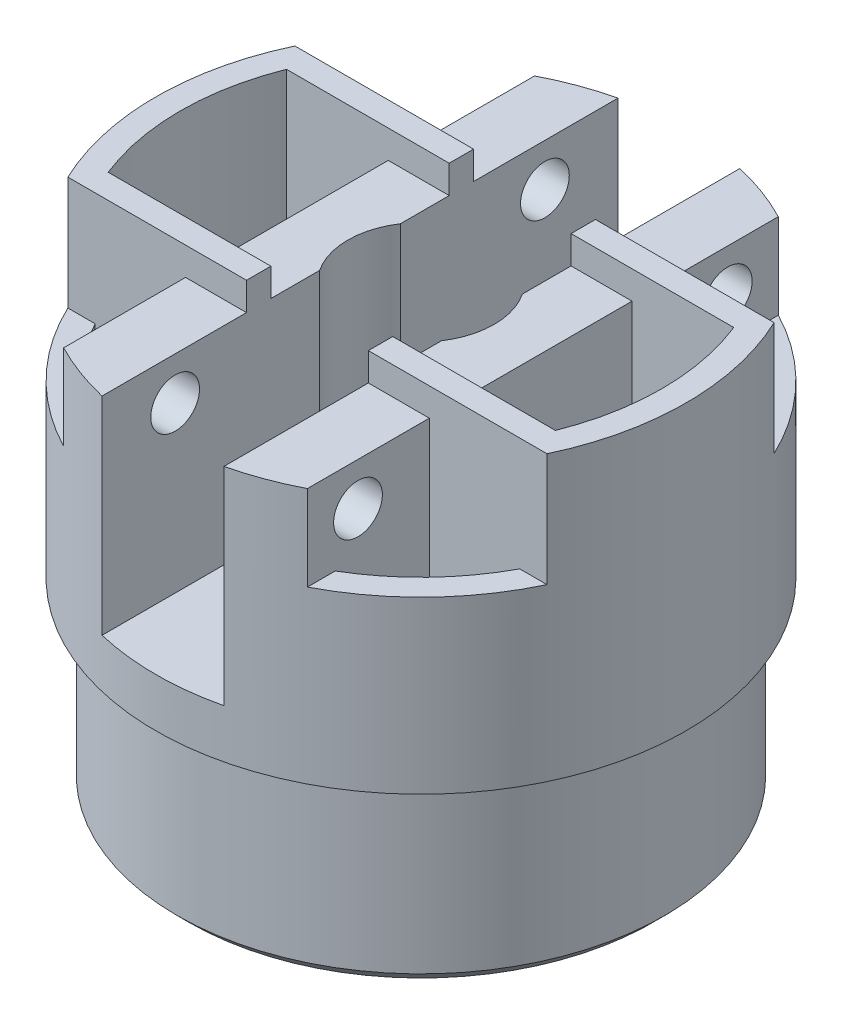
from build123d import *
from build123d.topology import SkipClean

# Parameters (mm, degrees)
HINGE_DEPTH           = 8.89
HINGE_2_DEPTH         = 8.89
SKETCH2_R             = 2.54
HINGE_HOLES_DEPTH     = 50.270844447
BODY_START            = 12.7
BODY_DEPTH            = 12.7
BOTTOM_PLATE_START    = 5.08
BOTTOM_PLATE_DEPTH    = 5.08
TUBE_CONNECTION_DEPTH = 19.05
BACKSTOP_DEPTH        = 2.921
CONNECT_TO_BASE_START = 12.7
CONNECT_TO_BASE_DEPTH = 12.7
SKETCH13_R            = 7.62
BOLT_ACCESS_DEPTH     = 21.59
BOTTOM_CHAMFER_SIZE   = 1.27


with BuildPart() as part:
    # Sketch1 → hinge (new body)
    with BuildSketch(Plane(origin=(0, 0, 0), x_dir=(1, 0, 0), z_dir=(0, 1, 0))):
        with BuildLine():
            ThreePointArc((-6.35, 26.882708313), (-9.597376484, 25.901599774), (-12.7, 24.529828908))
            Line((-12.7, 24.529828908), (-12.7, 11.829828908))
            Line((-12.7, 11.829828908), (-24.961122857, 11.829828908))
            ThreePointArc((-24.961122857, 11.829828908), (-26.9489436, 6.062750619), (-27.6225, 0))
            Line((-27.6225, 0), (-25.0825, 0))
            ThreePointArc((-25.0825, 0), (-24.632521559, 4.729766155), (-23.298731406, 9.289828908))
            Line((-23.298731406, 9.289828908), (-12.7, 9.289828908))
            Line((-12.7, 9.289828908), (-12.7, 0))
            Line((-12.7, 0), (-6.35, 0))
            Line((-6.35, 0), (-6.35, 26.882708313))
        make_face()
    hinge = extrude(amount=HINGE_DEPTH)


with BuildPart() as body_2:
    # Sketch1 → hinge 2 (new body)
    with BuildSketch(Plane(origin=(0, 0, 0), x_dir=(1, 0, 0), z_dir=(0, 1, 0))):
        with BuildLine():
            ThreePointArc((12.7, 24.529828908), (9.597376484, 25.901599774), (6.35, 26.882708313))
            Line((6.35, 26.882708313), (6.35, 0))
            Line((6.35, 0), (12.7, 0))
            Line((12.7, 0), (12.7, 9.289828908))
            Line((12.7, 9.289828908), (23.298731406, 9.289828908))
            ThreePointArc((23.298731406, 9.289828908), (24.632521559, 4.729766155), (25.0825, 0))
            Line((25.0825, 0), (27.6225, 0))
            ThreePointArc((27.6225, 0), (26.9489436, 6.062750619), (24.961122857, 11.829828908))
            Line((24.961122857, 11.829828908), (12.7, 11.829828908))
            Line((12.7, 11.829828908), (12.7, 24.529828908))
        make_face()
    hinge_2 = extrude(amount=HINGE_2_DEPTH)


with BuildPart() as hinge_holes_tool:
    # Sketch2 → hinge_holes (new, through all)
    with BuildSketch(Plane(origin=(12.7, 0, 0), x_dir=(0, 0, -1), z_dir=(1, 0, 0))):
        with Locations((19.262708313, 4.445)):
            Circle(SKETCH2_R)
    hinge_holes = extrude(amount=-HINGE_HOLES_DEPTH)


with BuildPart() as part_1:
    add(part.part)

    # hinge_holes: cut by hinge_holes_tool
    add(hinge_holes_tool.part, mode=Mode.SUBTRACT)



with BuildPart() as body_2_1:
    add(body_2.part)

    # hinge_holes: cut by hinge_holes_tool
    add(hinge_holes_tool.part, mode=Mode.SUBTRACT)


with BuildPart() as part_2:
    add(part_1.part)

    add(body_2_1.part)  # body merges body 2
    # Sketch5 → body (add)
    with BuildSketch(Plane.XZ.offset(BODY_START)):
        with BuildLine():
            Line((-27.6225, 0), (-25.0825, 0))
            ThreePointArc((-25.0825, 0), (-19.854542065, -15.327392656), (-6.35, -24.265393181))
            Line((-6.35, -24.265393181), (-6.35, -26.882708313))
            ThreePointArc((-6.35, -26.882708313), (-21.661087014, -17.140589711), (-27.6225, 0))
        make_face()
        with BuildLine():
            Line((25.0825, 0), (27.6225, 0))
            ThreePointArc((27.6225, 0), (21.661087014, -17.140589711), (6.35, -26.882708313))
            Line((6.35, -26.882708313), (6.35, -24.265393181))
            ThreePointArc((6.35, -24.265393181), (19.854542065, -15.327392656), (25.0825, 0))
        make_face()
    body = extrude(amount=-BODY_DEPTH)

    # Sketch6 → bottom_plate (add)
    with SkipClean():  # the faces are left unmerged after this step: merging them gives an invalid solid
        with BuildSketch(Plane.XZ.offset(12.7).offset(BOTTOM_PLATE_START)):
            with BuildLine():
                Line((13.97, 0), (3.81, 0))
                ThreePointArc((3.81, 0), (0, -3.81), (-3.81, 0))
                Line((-3.81, 0), (-13.97, 0))
                ThreePointArc((-13.97, 0), (-17.78, -3.81), (-21.59, 0))
                Line((-21.59, 0), (-27.6225, 0))
                ThreePointArc((-27.6225, 0), (0, -27.6225), (27.6225, 0))
                Line((27.6225, 0), (21.59, 0))
                ThreePointArc((21.59, 0), (17.78, -3.81), (13.97, 0))
            make_face()
        bottom_plate = extrude(amount=-BOTTOM_PLATE_DEPTH)

    # Sketch7 → tube_connection (add)
    with SkipClean():  # the faces are left unmerged after this step: merging them gives an invalid solid
        with BuildSketch(Plane.XZ.offset(17.78)):
            with BuildLine():
                Line((-22.86, 0), (-25.4, 0))
                ThreePointArc((-25.4, 0), (0, -25.4), (25.4, 0))
                Line((25.4, 0), (22.86, 0))
                ThreePointArc((22.86, 0), (0, -22.86), (-22.86, 0))
            make_face()
        tube_connection = extrude(amount=TUBE_CONNECTION_DEPTH)

    # Sketch10 → backstop (add)
    with SkipClean():  # the faces are left unmerged after this step: merging them gives an invalid solid
        with BuildSketch(Plane(origin=(0, 8.89, 0), x_dir=(1, 0, 0), z_dir=(0, 1, 0))):
            with BuildLine():
                Line((-23.298731406, 9.289828908), (-6.35, 9.289828908))
                Line((-6.35, 9.289828908), (-6.35, 11.829828908))
                Line((-6.35, 11.829828908), (-24.961122857, 11.829828908))
                ThreePointArc((-24.961122857, 11.829828908), (-26.9489436, 6.062750619), (-27.6225, 0))
                Line((-27.6225, 0), (-25.0825, 0))
                ThreePointArc((-25.0825, 0), (-24.632521559, 4.729766155), (-23.298731406, 9.289828908))
            make_face()
            with BuildLine():
                Line((6.35, 11.829828908), (24.961122857, 11.829828908))
                ThreePointArc((24.961122857, 11.829828908), (26.9489436, 6.062750619), (27.6225, 0))
                Line((27.6225, 0), (25.0825, 0))
                ThreePointArc((25.0825, 0), (24.632521559, 4.729766155), (23.298731406, 9.289828908))
                Line((23.298731406, 9.289828908), (6.35, 9.289828908))
                Line((6.35, 9.289828908), (6.35, 11.829828908))
            make_face()
        backstop = extrude(amount=BACKSTOP_DEPTH)

    # Mirror1: hinge, hinge 2, hinge_holes, body, bottom_plate, tube_connection, backstop across plane
    with SkipClean():  # the faces are left unmerged after this step: merging them gives an invalid solid
        add(hinge.mirror(Plane(origin=(0, 8.89, 0), x_dir=(1, 0, 0), z_dir=(0, 0, 1))))
        add(hinge_2.mirror(Plane(origin=(0, 8.89, 0), x_dir=(1, 0, 0), z_dir=(0, 0, 1))))
        add(hinge_holes.mirror(Plane(origin=(0, 8.89, 0), x_dir=(1, 0, 0), z_dir=(0, 0, 1))), mode=Mode.SUBTRACT)
        add(body.mirror(Plane(origin=(0, 8.89, 0), x_dir=(1, 0, 0), z_dir=(0, 0, 1))))
        add(bottom_plate.mirror(Plane(origin=(0, 8.89, 0), x_dir=(1, 0, 0), z_dir=(0, 0, 1))))
        add(tube_connection.mirror(Plane(origin=(0, 8.89, 0), x_dir=(1, 0, 0), z_dir=(0, 0, 1))))
        add(backstop.mirror(Plane(origin=(0, 8.89, 0), x_dir=(1, 0, 0), z_dir=(0, 0, 1))))

    # Sketch12 → connect_to_base (add)
    with SkipClean():  # the faces are left unmerged after this step: merging them gives an invalid solid
        with BuildSketch(Plane.XZ.offset(CONNECT_TO_BASE_START)):
            with BuildLine():
                Line((-6.35, -24.265393181), (-6.35, 24.265393181))
                ThreePointArc((-6.35, 24.265393181), (-9.615737574, 23.166126071), (-12.7, 21.629651089))
                Line((-12.7, 21.629651089), (-12.7, 11.829828908))
                Line((-12.7, 11.829828908), (-22.117571165, 11.829828908))
                ThreePointArc((-22.117571165, 11.829828908), (-22.743637238, 10.576330717), (-23.298731406, 9.289828908))
                Line((-23.298731406, 9.289828908), (-12.7, 9.289828908))
                Line((-12.7, 9.289828908), (-12.7, -9.289828908))
                Line((-12.7, -9.289828908), (-23.298731406, -9.289828908))
                ThreePointArc((-23.298731406, -9.289828908), (-22.743637238, -10.576330717), (-22.117571165, -11.829828908))
                Line((-22.117571165, -11.829828908), (-12.7, -11.829828908))
                Line((-12.7, -11.829828908), (-12.7, -21.629651089))
                ThreePointArc((-12.7, -21.629651089), (-9.615737574, -23.166126071), (-6.35, -24.265393181))
            make_face()
            with BuildLine():
                Line((12.7, 9.289828908), (23.298731406, 9.289828908))
                ThreePointArc((23.298731406, 9.289828908), (22.743637238, 10.576330717), (22.117571165, 11.829828908))
                Line((22.117571165, 11.829828908), (12.7, 11.829828908))
                Line((12.7, 11.829828908), (12.7, 21.629651089))
                ThreePointArc((12.7, 21.629651089), (9.615737574, 23.166126071), (6.35, 24.265393181))
                Line((6.35, 24.265393181), (6.35, -24.265393181))
                ThreePointArc((6.35, -24.265393181), (9.615737574, -23.166126071), (12.7, -21.629651089))
                Line((12.7, -21.629651089), (12.7, -11.829828908))
                Line((12.7, -11.829828908), (22.117571165, -11.829828908))
                ThreePointArc((22.117571165, -11.829828908), (22.743637238, -10.576330717), (23.298731406, -9.289828908))
                Line((23.298731406, -9.289828908), (12.7, -9.289828908))
                Line((12.7, -9.289828908), (12.7, 9.289828908))
            make_face()
        extrude(amount=-CONNECT_TO_BASE_DEPTH)
    add(part_2.part.scale(1), mode=Mode.REPLACE)  # the faces are merged on a copy

    # Sketch13 → bolt_access (cut)
    with BuildSketch(Plane(origin=(0, -12.7, 0), x_dir=(1, 0, 0), z_dir=(0, 1, 0))):
        Circle(SKETCH13_R)
    extrude(amount=BOLT_ACCESS_DEPTH, mode=Mode.SUBTRACT)

    # bottom_chamfer
    bottom_chamfer_edges = [part_2.edges().sort_by_distance(p)[0] for p in [
        (0, -36.83, -25.4),
    ]]
    chamfer(bottom_chamfer_edges, length=BOTTOM_CHAMFER_SIZE)


solid = part_2.part
